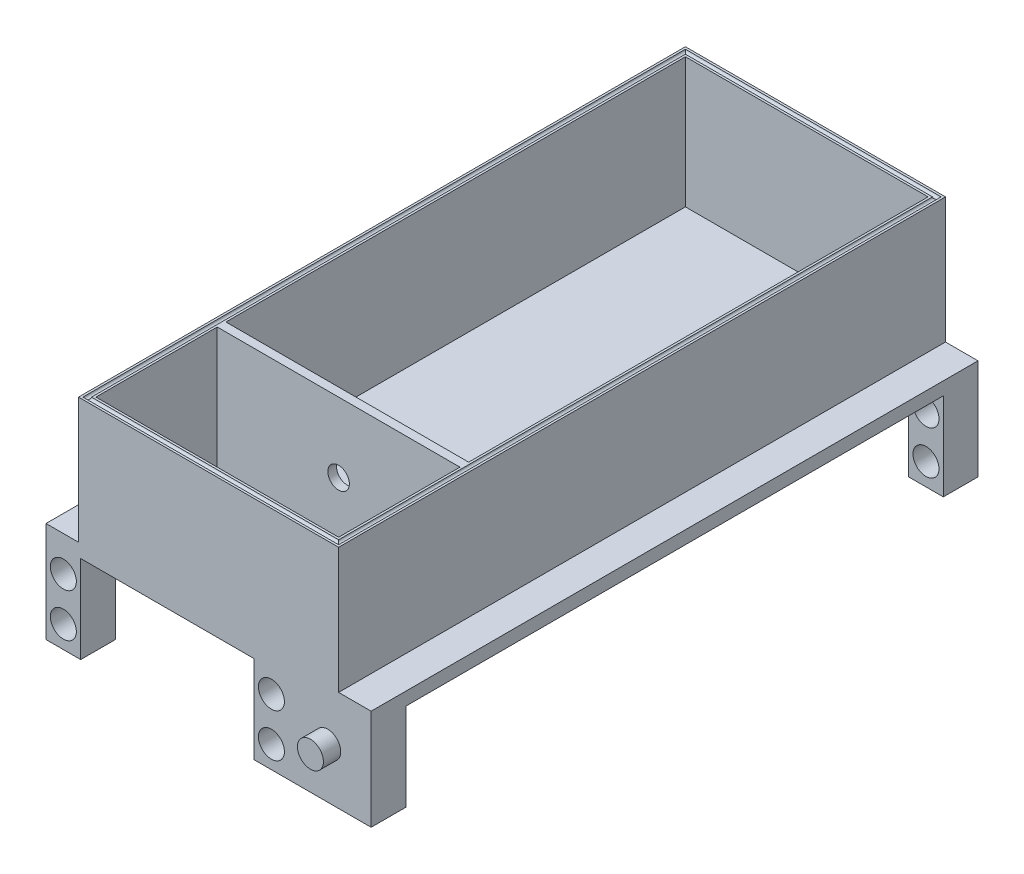
from build123d import *

# Parameters (mm, degrees)
SKETCH1_W            = 60
SKETCH1_H            = 110
BOSS_EXTRUDE1_DEPTH  = 2
SKETCH2_W            = 60
SKETCH2_H            = 110
SKETCH2_W_2          = 56
SKETCH2_H_2          = 106
BOSS_EXTRUDE2_DEPTH  = 30
SKETCH3_W            = 60
SKETCH3_H            = 30
BOSS_EXTRUDE3_DEPTH  = 2
BOSS_EXTRUDE4_DEPTH  = 30
SKETCH5_R            = 2.486759959
CUT_EXTRUDE1_DEPTH   = 30
CUT_SWEEP1_PROFILE_R = 0.5
SKETCH43_W           = 7.5
SKETCH43_H           = 140
BOSS_EXTRUDE7_DEPTH  = 3
SKETCH55_W           = 8
SKETCH55_H           = 8
SKETCH55_W_2         = 27
BOSS_EXTRUDE10_DEPTH = 20.2
SKETCH56_R           = 3
CUT_EXTRUDE3_DEPTH   = 20.2
SKETCH59_R           = 3
CUT_EXTRUDE4_DEPTH   = 20.2
SKETCH60_R           = 3
BOSS_EXTRUDE11_DEPTH = 4
SKETCH61_R           = 3
BOSS_EXTRUDE12_DEPTH = 4


with BuildPart() as part:
    # Sketch1 → Boss-Extrude1 (new body)
    with BuildSketch(Plane(origin=(0, 0, 0), x_dir=(1, 0, 0), z_dir=(0, 1, 0))):
        Rectangle(SKETCH1_W, SKETCH1_H)
    extrude(amount=BOSS_EXTRUDE1_DEPTH)

    # Sketch2 → Boss-Extrude2 (add)
    with BuildSketch(Plane(origin=(0, 2, 0), x_dir=(1, 0, 0), z_dir=(0, 1, 0))):
        Rectangle(SKETCH2_W, SKETCH2_H)
        Rectangle(SKETCH2_W_2, SKETCH2_H_2, mode=Mode.SUBTRACT)
    extrude(amount=BOSS_EXTRUDE2_DEPTH)

    # Sketch3 → Boss-Extrude3 (add)
    with BuildSketch(Plane(origin=(0, 0, 0), x_dir=(1, 0, 0), z_dir=(0, 1, 0))):
        with Locations((0, -70)):
            Rectangle(SKETCH3_W, SKETCH3_H)
    extrude(amount=BOSS_EXTRUDE3_DEPTH)

    # Sketch4 → Boss-Extrude4 (add)
    with BuildSketch(Plane(origin=(0, 2, 0), x_dir=(1, 0, 0), z_dir=(0, 1, 0))):
        Polygon((-28, -55), (-30, -55), (-30, -85), (30, -85), (30, -55), (28, -55), (28, -83), (-28, -83), align=None)
    extrude(amount=BOSS_EXTRUDE4_DEPTH)

    # Sketch5 → Cut-Extrude1 (cut)
    with BuildSketch(Plane.XY.offset(55)):
        with Locations((0, 15.890944925)):
            Circle(SKETCH5_R)
    extrude(amount=-CUT_EXTRUDE1_DEPTH, mode=Mode.SUBTRACT)

    # Cut-Sweep1: sweep along a path in Sketch6
    with BuildLine(Plane(origin=(0, 32, 0), x_dir=(1, 0, 0), z_dir=(0, 1, 0))) as cut_sweep1_path:
        Line((-29, 54), (-29, -84))
        Line((-29, -84), (29, -84))
        Line((29, -84), (29, 54))
        Line((29, 54), (-29, 54))
    # Cut-Sweep1 profile (on start of the path) → Cut-Sweep1 (sweep, cut)
    with BuildSketch(Plane(origin=(-29, 32, -54), x_dir=(1, 0, 0), z_dir=(0, 0, 1))):
        Circle(CUT_SWEEP1_PROFILE_R)
    sweep(path=cut_sweep1_path.line, transition=Transition.RIGHT, mode=Mode.SUBTRACT)

    # Sketch43 → Boss-Extrude7 (add)
    with BuildSketch(Plane.XZ):
        with Locations((33.75, 15)):
            Rectangle(SKETCH43_W, SKETCH43_H)
        Polygon((-30, -55), (-37.5, -55), (-37.5, 85), (-30, 85), (-30, 55), align=None)
    extrude(amount=-BOSS_EXTRUDE7_DEPTH)

    # Sketch55 → Boss-Extrude10 (add)
    with BuildSketch(Plane.XZ):
        with Locations((-33.5, 81)):
            Rectangle(SKETCH55_W, SKETCH55_H)
        with Locations((24, 81)):
            Rectangle(SKETCH55_W_2, SKETCH55_H)
        with Locations((33.5, -51)):
            Rectangle(SKETCH55_W, SKETCH55_H)
        with Locations((-24, -51)):
            Rectangle(SKETCH55_W_2, SKETCH55_H)
    extrude(amount=BOSS_EXTRUDE10_DEPTH)

    # Sketch56 → Cut-Extrude3 (cut)
    with BuildSketch(Plane.XY.offset(85)):
        with Locations((-33.5, -15.1)):
            Circle(SKETCH56_R)
        with Locations((-33.5, -5.1)):
            Circle(SKETCH56_R)
        with Locations((14.5, -15.1)):
            Circle(SKETCH56_R)
        with Locations((14.5, -5.1)):
            Circle(SKETCH56_R)
    extrude(amount=-CUT_EXTRUDE3_DEPTH, mode=Mode.SUBTRACT)

    # Sketch59 → Cut-Extrude4 (cut)
    with BuildSketch(Plane(origin=(0, 0, -55), x_dir=(-1, 0, 0), z_dir=(0, 0, -1))):
        with Locations((-33.5, -15.1)):
            Circle(SKETCH59_R)
        with Locations((-33.5, -5.1)):
            Circle(SKETCH59_R)
        with Locations((14.5, -5.1)):
            Circle(SKETCH59_R)
        with Locations((14.5, -15.1)):
            Circle(SKETCH59_R)
    extrude(amount=-CUT_EXTRUDE4_DEPTH, mode=Mode.SUBTRACT)

    # Sketch60 → Boss-Extrude11 (add)
    with BuildSketch(Plane(origin=(0, 0, -55), x_dir=(-1, 0, 0), z_dir=(0, 0, -1))):
        with Locations((27.5, -8.6)):
            Circle(SKETCH60_R)
    extrude(amount=BOSS_EXTRUDE11_DEPTH)

    # Sketch61 → Boss-Extrude12 (add)
    with BuildSketch(Plane.XY.offset(85)):
        with Locations((27.5, -8.6)):
            Circle(SKETCH61_R)
    extrude(amount=BOSS_EXTRUDE12_DEPTH)


solid = part.part
